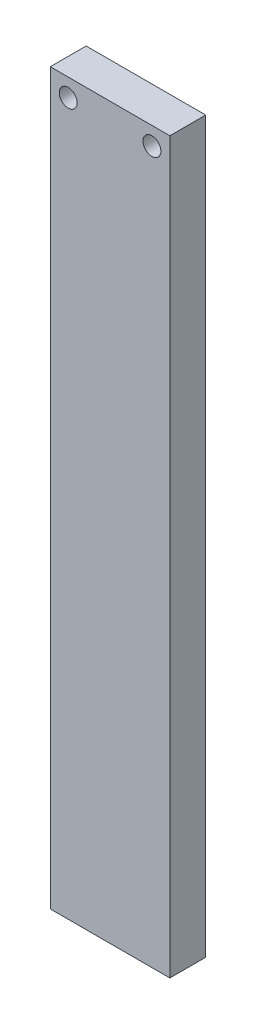
from build123d import *

# Parameters (mm, degrees)
ESQUISSE1_W             = 20
ESQUISSE1_H             = 122
BOSS_EXTRU_1_DEPTH      = 6
ESQUISSE2_R             = 1.5
ENL_V_MAT_EXTRU_1_DEPTH = 6


with BuildPart() as part:
    # Esquisse1 → Boss.-Extru.1 (new body)
    with BuildSketch(Plane.XY):
        with Locations((0, 23)):
            Rectangle(ESQUISSE1_W, ESQUISSE1_H)
    extrude(amount=BOSS_EXTRU_1_DEPTH)

    # Esquisse2 → Enlèv. mat.-Extru.1 (cut)
    with BuildSketch(Plane.XY.offset(6)):
        with Locations((-7, 81)):
            Circle(ESQUISSE2_R)
        with Locations((7, 81)):
            Circle(ESQUISSE2_R)
    extrude(amount=-ENL_V_MAT_EXTRU_1_DEPTH, mode=Mode.SUBTRACT)


solid = part.part
